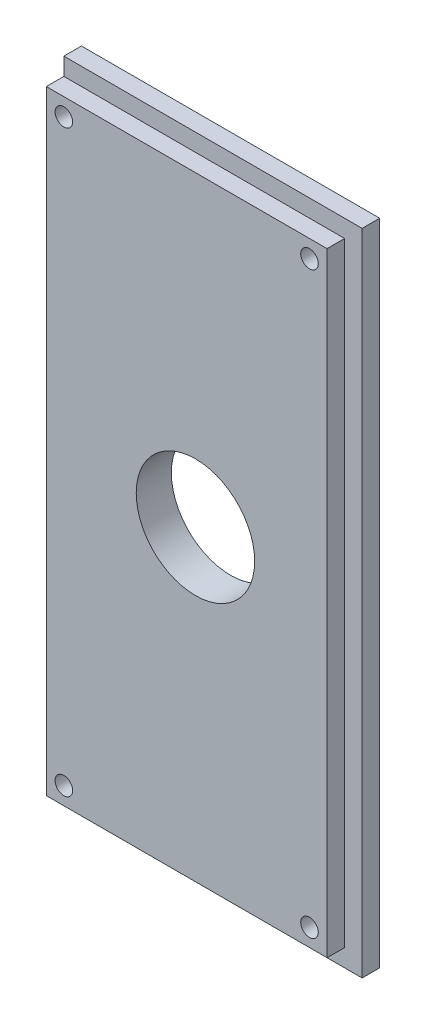
from build123d import *

# Parameters (mm, degrees)
ESQUISSE1_W             = 34
ESQUISSE1_H             = 74
BOSS_EXTRU_1_DEPTH      = 2
ESQUISSE2_W             = 32
ESQUISSE2_H             = 70
BOSS_EXTRU_2_DEPTH      = 2
SKETCH1_R               = 6.75
CUT_EXTRUDE1_DEPTH      = 41.914545091
ESQUISSE3_R             = 1
ENL_V_MAT_EXTRU_1_DEPTH = 41.914545091
ESQUISSE4_W             = 10
ESQUISSE4_H             = 10
BOSS_EXTRU_3_DEPTH      = 2
CONG_1_R                = 2


with BuildPart() as part:
    # Esquisse1 → Boss.-Extru.1 (new body)
    with BuildSketch(Plane.XY):
        Rectangle(ESQUISSE1_W, ESQUISSE1_H)
    extrude(amount=BOSS_EXTRU_1_DEPTH)

    # Esquisse2 → Boss.-Extru.2 (add)
    with BuildSketch(Plane.XY.offset(2)):
        with Locations((-1, 0)):
            Rectangle(ESQUISSE2_W, ESQUISSE2_H)
    extrude(amount=BOSS_EXTRU_2_DEPTH)

    # Sketch1 → Cut-Extrude1 (cut, through all)
    with BuildSketch(Plane(origin=(0, 0, 0), x_dir=(-1, 0, 0), z_dir=(0, 0, -1))):
        Circle(SKETCH1_R)
    extrude(amount=-CUT_EXTRUDE1_DEPTH, mode=Mode.SUBTRACT)

    # Esquisse3 → Enlèv. mat.-Extru.1 (cut, through all)
    with BuildSketch(Plane.XY.offset(4)):
        with Locations((-15, 33)):
            Circle(ESQUISSE3_R)
        with Locations((13, 33)):
            Circle(ESQUISSE3_R)
        with Locations((13, -33)):
            Circle(ESQUISSE3_R)
        with Locations((-15, -33)):
            Circle(ESQUISSE3_R)
    extrude(amount=-ENL_V_MAT_EXTRU_1_DEPTH, mode=Mode.SUBTRACT)

    # Esquisse4 → Boss.-Extru.3 (add)
    with BuildSketch(Plane(origin=(0, 0, 0), x_dir=(-1, 0, 0), z_dir=(0, 0, -1))):
        with Locations((16, 0)):
            Rectangle(ESQUISSE4_W, ESQUISSE4_H)
    extrude(amount=BOSS_EXTRU_3_DEPTH)

    # Congé1
    cong_1_edges = [part.edges().sort_by_distance(p)[0] for p in [
        (-14, -5, 0),
        (-11, 0, 0),
        (-14, 5, 0),
        (-21, 5, -1),
        (-21, -5, -1),
    ]]
    fillet(cong_1_edges, radius=CONG_1_R - 0.0001)  # a hair under: the kernel refuses the full size


solid = part.part
